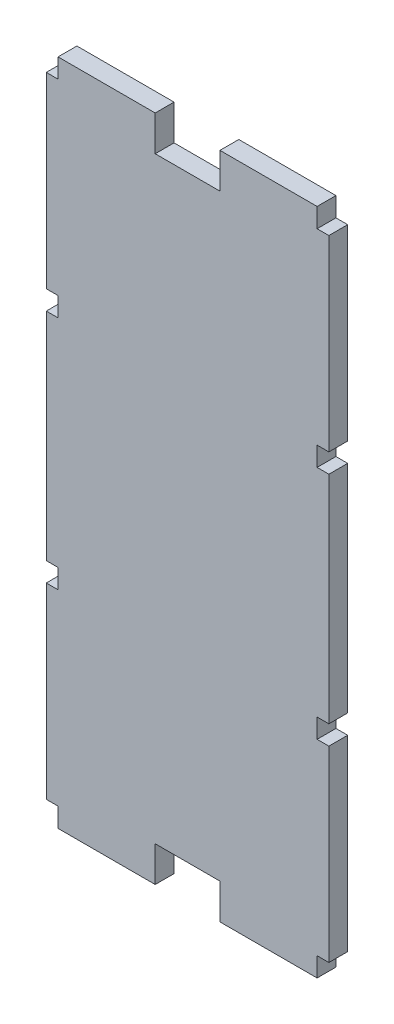
from build123d import *

# Parameters (mm, degrees)
SKETCH1_W           = 76.2
SKETCH1_H           = 180.18125
BOSS_EXTRUDE1_DEPTH = 5.08
SKETCH3_W           = 17.4625
SKETCH3_H           = 9.525
CUT_EXTRUDE1_DEPTH  = 98.947624335
SKETCH4_W           = 3.175
SKETCH4_H           = 5.207
CUT_EXTRUDE2_DEPTH  = 98.947624335


with BuildPart() as part:
    # Sketch1 → Boss-Extrude1 (new body)
    with BuildSketch(Plane.XY):
        Rectangle(SKETCH1_W, SKETCH1_H)
    extrude(amount=BOSS_EXTRUDE1_DEPTH)

    # Sketch3 → Cut-Extrude1 (cut, through all)
    with BuildSketch(Plane.XY.offset(5.08)):
        with Locations((0, -85.328125)):
            Rectangle(SKETCH3_W, SKETCH3_H)
        with Locations((0, 85.328125)):
            Rectangle(SKETCH3_W, SKETCH3_H)
    extrude(amount=-CUT_EXTRUDE1_DEPTH, mode=Mode.SUBTRACT)

    # Sketch4 → Cut-Extrude2 (cut, through all)
    with BuildSketch(Plane.XY.offset(5.08)):
        with Locations((36.5125, 87.487125)):
            Rectangle(SKETCH4_W, SKETCH4_H)
        with Locations((-36.5125, 87.487125)):
            Rectangle(SKETCH4_W, SKETCH4_H)
        with Locations((-36.5125, -87.487125)):
            Rectangle(SKETCH4_W, SKETCH4_H)
        with Locations((36.5125, -87.487125)):
            Rectangle(SKETCH4_W, SKETCH4_H)
        with Locations((36.5125, 31.75)):
            Rectangle(SKETCH4_W, SKETCH4_H)
        with Locations((36.5125, -31.75)):
            Rectangle(SKETCH4_W, SKETCH4_H)
        with Locations((-36.5125, -31.75)):
            Rectangle(SKETCH4_W, SKETCH4_H)
        with Locations((-36.5125, 31.75)):
            Rectangle(SKETCH4_W, SKETCH4_H)
    extrude(amount=-CUT_EXTRUDE2_DEPTH, mode=Mode.SUBTRACT)


solid = part.part
